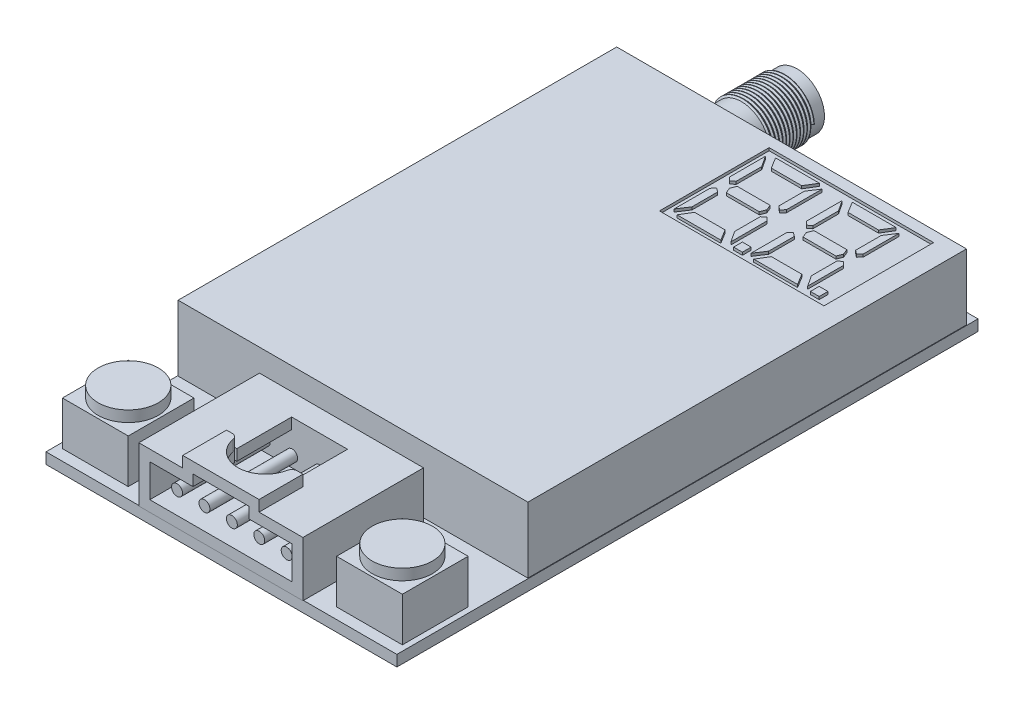
from build123d import *

# Parameters (mm, degrees)
IZIM1_W                       = 32
IZIM1_H                       = 53
Y_KSEKLIK_EKSTR_ZYON1_DEPTH   = 1
IZIM2_W                       = 31.9
IZIM2_H                       = 40
Y_KSEKLIK_EKSTR_ZYON2_DEPTH   = 6
IZIM3_W                       = 6
IZIM3_H                       = 6
Y_KSEKLIK_EKSTR_ZYON5_DEPTH   = 4
IZIM7_R                       = 2.75
Y_KSEKLIK_EKSTR_ZYON6_DEPTH   = 1
Y_KSEKLIK_EKSTR_ZYON8_START   = 0.05
IZIM11_W                      = 14.962008344
IZIM11_H                      = 5
Y_KSEKLIK_EKSTR_ZYON8_DEPTH   = 11
Y_KSEKLIK_EKSTR_ZYON9_DEPTH   = 4
KES_EKSTR_ZYON2_DEPTH         = 4
KES_EKSTR_ZYON1_DEPTH         = 9
IZIM18_W                      = 6
IZIM18_H                      = 6
Y_KSEKLIK_EKSTR_ZYON11_DEPTH  = 1.5
IZIM19_R                      = 2.5
Y_KSEKLIK_EKSTR_ZYON12_DEPTH  = 8
IZIM20_R                      = 2.25
IZIM20_R_2                    = 0.5
KES_EKSTR_ZYON3_DEPTH         = 3
MINCOLWIDTH_ONTRACKING1_PITCH = 0.3175
IZIM25_W                      = 15
IZIM25_H                      = 10
KES_EKSTR_ZYON4_DEPTH         = 0.25
IZIM27_W                      = 0.8
IZIM27_H                      = 0.8
Y_KSEKLIK_EKSTR_ZYON13_DEPTH  = 0.25
IZIM28_R                      = 0.5
Y_KSEKLIK_EKSTR_ZYON14_DEPTH  = 8


with BuildPart() as part:
    # Çizim1 → Yükseklik-Ekstrüzyon1 (new body)
    with BuildSketch(Plane(origin=(0, 0, 0), x_dir=(1, 0, 0), z_dir=(0, 1, 0))):
        Rectangle(IZIM1_W, IZIM1_H)
    extrude(amount=Y_KSEKLIK_EKSTR_ZYON1_DEPTH)

    # Çizim3 → Yükseklik-Ekstrüzyon5 (add)
    with BuildSketch(Plane(origin=(0, 1, 0), x_dir=(1, 0, 0), z_dir=(0, 1, 0))):
        with Locations((12.5, -22.5)):
            Rectangle(IZIM3_W, IZIM3_H)
        with Locations((-12.5, -22.5)):
            Rectangle(IZIM3_W, IZIM3_H)
    extrude(amount=Y_KSEKLIK_EKSTR_ZYON5_DEPTH)

    # Çizim7 → Yükseklik-Ekstrüzyon6 (add)
    with BuildSketch(Plane(origin=(0, 5, 0), x_dir=(1, 0, 0), z_dir=(0, 1, 0))):
        with Locations(Location((-12.5, -22.5, 0), (0, 0, 90))):
            Circle(IZIM7_R)
        with Locations(Location((12.5, -22.5, 0), (0, 0, 90))):
            Circle(IZIM7_R)
    extrude(amount=Y_KSEKLIK_EKSTR_ZYON6_DEPTH)



with BuildPart() as body_2:
    # Çizim2 → Yükseklik-Ekstrüzyon2 (new body)
    with BuildSketch(Plane(origin=(0, 1, 0), x_dir=(1, 0, 0), z_dir=(0, 1, 0))):
        with Locations((0, 5.5)):
            Rectangle(IZIM2_W, IZIM2_H)
    extrude(amount=Y_KSEKLIK_EKSTR_ZYON2_DEPTH)

    # Çizim25 → Kes-Ekstrüzyon4 (cut)
    with BuildSketch(Plane(origin=(0, 7, 0), x_dir=(1, 0, 0), z_dir=(0, 1, 0))):
        with Locations((6.45, 19.5)):
            Rectangle(IZIM25_W, IZIM25_H)
    extrude(amount=-KES_EKSTR_ZYON4_DEPTH, mode=Mode.SUBTRACT)


with BuildPart() as body_3:
    # Çizim11 → Yükseklik-Ekstrüzyon8 (new body)
    with BuildSketch(Plane.XY.offset(26.5).offset(Y_KSEKLIK_EKSTR_ZYON8_START)):
        with Locations((0, 3.5)):
            Rectangle(IZIM11_W, IZIM11_H)
    extrude(amount=-Y_KSEKLIK_EKSTR_ZYON8_DEPTH)


with BuildPart() as part_1:
    add(part.part)

    add(body_3.part)  # Yükseklik-Ekstrüzyon9 merges body 3
    # Çizim15 → Yükseklik-Ekstrüzyon9 (add)
    with BuildSketch(Plane.XY.offset(26.55)):
        Polygon((0, 6), (3.481004172, 6), (3.481004172, 7), (-3.481004172, 7), (-3.481004172, 6), align=None)
    extrude(amount=-Y_KSEKLIK_EKSTR_ZYON9_DEPTH)

    # Çizim16 → Kes-Ekstrüzyon2 (cut)
    with BuildSketch(Plane(origin=(0, 7, 0), x_dir=(1, 0, 0), z_dir=(0, 1, 0))):
        with BuildLine():
            Line((2.958039892, -22.55), (2, -22.55))
            Line((2, -22.55), (2, -17.55))
            Line((2, -17.55), (-2, -17.55))
            Line((-2, -17.55), (-2, -22.55))
            Line((-2, -22.55), (-2.958039892, -22.55))
            ThreePointArc((-2.958039892, -22.55), (-2.639104087, -22.66492864), (-2.466787715, -22.95688019))
            ThreePointArc((-2.466787715, -22.95688019), (0, -25), (2.466787715, -22.95688019))
            ThreePointArc((2.466787715, -22.95688019), (2.639104087, -22.66492864), (2.958039892, -22.55))
        make_face()
    extrude(amount=-KES_EKSTR_ZYON2_DEPTH, mode=Mode.SUBTRACT)

    # Çizim12 → Kes-Ekstrüzyon1 (cut)
    with BuildSketch(Plane.XY.offset(26.55)):
        Polygon((-6.481004172, 2), (6.481004172, 2), (6.481004172, 5), (2.547818284, 5), (2.547818284, 6.004832737), (-2.547818284, 6.004832737), (-2.547818284, 5), (-6.481004172, 5), align=None)
    extrude(amount=-KES_EKSTR_ZYON1_DEPTH, mode=Mode.SUBTRACT)

    # Çizim18 → Yükseklik-Ekstrüzyon11 (add)
    with BuildSketch(Plane(origin=(0, 0, -26.5), x_dir=(-1, 0, 0), z_dir=(0, 0, -1))):
        with Locations((10, 0.5)):
            Rectangle(IZIM18_W, IZIM18_H)
    extrude(amount=Y_KSEKLIK_EKSTR_ZYON11_DEPTH)

    # Çizim19 → Yükseklik-Ekstrüzyon12 (add)
    with BuildSketch(Plane(origin=(0, 0, -28), x_dir=(-1, 0, 0), z_dir=(0, 0, -1))):
        with Locations((10, 0.5)):
            Circle(IZIM19_R)
    extrude(amount=Y_KSEKLIK_EKSTR_ZYON12_DEPTH)

    # Çizim20 → Kes-Ekstrüzyon3 (cut)
    with BuildSketch(Plane(origin=(0, 0, -36), x_dir=(-1, 0, 0), z_dir=(0, 0, -1))):
        with Locations((10, 0.5)):
            Circle(IZIM20_R)
        with Locations((10, 0.5)):
            Circle(IZIM20_R_2, mode=Mode.SUBTRACT)
    extrude(amount=-KES_EKSTR_ZYON3_DEPTH, mode=Mode.SUBTRACT)

    # MinColWidth_OnTracking1: the profile of HeaderRowsCount1 profile screwed along a right-hand helix of 12.598425 turns, 6 arcs to a turn; built about Z, then put on its axis
    mincolwidth_ontracking1_z = Axis((0, 0, 0), (0, 0, 1))
    mincolwidth_ontracking1_corners = [(2.4997, 0, -0.000173205), (2.671851915, 0, 0.09921875), (2.671851915, 0, 0.13890625), (2.4997, 0, 0.238298204)]
    with BuildLine(mode=Mode.PRIVATE) as mincolwidth_ontracking1_profile:
        Line(mincolwidth_ontracking1_corners[0], mincolwidth_ontracking1_corners[1])
        Line(mincolwidth_ontracking1_corners[1], mincolwidth_ontracking1_corners[2])
        Line(mincolwidth_ontracking1_corners[2], mincolwidth_ontracking1_corners[3])
        Line(mincolwidth_ontracking1_corners[3], mincolwidth_ontracking1_corners[0])
    mincolwidth_ontracking1_cap = Face(mincolwidth_ontracking1_profile.wire())
    mincolwidth_ontracking1_turn_angles = [0, 30, 60, 90, 120, 150, 180, 210, 240, 270, 300, 330, 360]
    mincolwidth_ontracking1_turn_weights = [1, 0.8660254037844387, 1, 0.8660254037844387, 1, 0.8660254037844387, 1, 0.8660254037844387, 1, 0.8660254037844387, 1, 0.8660254037844387, 1]
    mincolwidth_ontracking1_turn_rails = [Edge.make_bspline([Vector(p[0], p[1], 0).rotate(mincolwidth_ontracking1_z, mincolwidth_ontracking1_turn_angles[k]) / mincolwidth_ontracking1_turn_weights[k] + Vector(0, 0, p[2] + MINCOLWIDTH_ONTRACKING1_PITCH * mincolwidth_ontracking1_turn_angles[k] / 360) for k in range(13)], [0, 0, 0, 1, 1, 2, 2, 3, 3, 4, 4, 5, 5, 6, 6, 6], 2, mincolwidth_ontracking1_turn_weights) for p in mincolwidth_ontracking1_corners]
    mincolwidth_ontracking1_turn_sides = [Face.make_surface_from_curves(mincolwidth_ontracking1_turn_rails[p[0]], mincolwidth_ontracking1_turn_rails[p[1]]) for p in [(0, 1), (1, 2), (2, 3), (3, 0)]]
    mincolwidth_ontracking1_last_angles = [4320, 4350, 4380, 4410, 4440, 4470, 4500, 4517.716535433, 4535.433070866]
    mincolwidth_ontracking1_last_weights = [1, 0.8660254037844387, 1, 0.8660254037844387, 1, 0.8660254037844387, 1, 0.9525736983244478, 1]
    mincolwidth_ontracking1_last_rails = [Edge.make_bspline([Vector(p[0], p[1], 0).rotate(mincolwidth_ontracking1_z, mincolwidth_ontracking1_last_angles[k]) / mincolwidth_ontracking1_last_weights[k] + Vector(0, 0, p[2] + MINCOLWIDTH_ONTRACKING1_PITCH * mincolwidth_ontracking1_last_angles[k] / 360) for k in range(9)], [0, 0, 0, 1, 1, 2, 2, 3, 3, 4, 4, 4], 2, mincolwidth_ontracking1_last_weights) for p in mincolwidth_ontracking1_corners]
    mincolwidth_ontracking1_last_sides = [Face.make_surface_from_curves(mincolwidth_ontracking1_last_rails[p[0]], mincolwidth_ontracking1_last_rails[p[1]]) for p in [(0, 1), (1, 2), (2, 3), (3, 0)]]
    mincolwidth_ontracking1 = Plane(origin=(-10, 0.5, -35), x_dir=(1, 0, 0), z_dir=(0, 0, 1)) * Solid(Shell([*[p.moved(Location((0, 0, MINCOLWIDTH_ONTRACKING1_PITCH * i))) for i in range(12) for p in mincolwidth_ontracking1_turn_sides], *mincolwidth_ontracking1_last_sides, mincolwidth_ontracking1_cap, mincolwidth_ontracking1_cap.rotate(mincolwidth_ontracking1_z, 4535.433070866).moved(Location((0, 0, MINCOLWIDTH_ONTRACKING1_PITCH * 4535.433070866 / 360)))]))
    add(mincolwidth_ontracking1)


    add(body_2.part)  # Yükseklik-Ekstrüzyon13 merges body 2
    # Çizim27 → Yükseklik-Ekstrüzyon13 (add)
    with BuildSketch(Plane(origin=(0, 6.75, 0), x_dir=(1, 0, 0), z_dir=(0, 1, 0))):
        Polygon((0.664771137, 22.983042347), (0.053377685, 23.983042347), (4.053377685, 23.983042347), (3.441984232, 22.983042347), align=None)
        Polygon((4.342102553, 20.072969491), (3.9997405, 20.335985377), (3.9997405, 22.670153942), (4.643229286, 23.649809054), (4.643229286, 20.381168795), align=None)
        Polygon((0.553377685, 18.987819224), (0.664771137, 18.987819224), (3.441984232, 18.987819224), (3.553377685, 18.987819224), (3.751485955, 19.487819224), (3.553377685, 19.987819224), (3.441984232, 19.987819224), (0.664771137, 19.987819224), (0.553377685, 19.987819224), (0.355269415, 19.487819224), align=None)
        Polygon((0.107014869, 22.670153942), (0.107014869, 20.335985377), (-0.235347184, 20.072969491), (-0.536473917, 20.381168795), (-0.536473917, 23.649809054), align=None)
        Polygon((-0.235347184, 18.902668958), (0.107014869, 18.639653071), (0.107014869, 16.305484506), (-0.536473917, 15.325829395), (-0.536473917, 18.594469653), align=None)
        Polygon((3.441984232, 15.992596102), (4.053377685, 14.992596102), (0.053377685, 14.992596102), (0.664771137, 15.992596102), align=None)
        Polygon((3.9997405, 16.305484506), (3.9997405, 18.639653071), (4.342102553, 18.902668958), (4.643229286, 18.594469653), (4.643229286, 15.325829395), align=None)
        with Locations((5.589399196, 15.424217029)):
            Rectangle(IZIM27_W, IZIM27_H)
        Polygon((6.764652816, 18.902668958), (7.107014869, 18.639653071), (7.107014869, 16.305484506), (6.463526083, 15.325829395), (6.463526083, 18.594469653), align=None)
        Polygon((7.553377685, 18.987819224), (7.664771137, 18.987819224), (10.441984232, 18.987819224), (10.553377685, 18.987819224), (10.751485955, 19.487819224), (10.553377685, 19.987819224), (10.441984232, 19.987819224), (7.664771137, 19.987819224), (7.553377685, 19.987819224), (7.355269415, 19.487819224), align=None)
        Polygon((7.107014869, 22.670153942), (7.107014869, 20.335985377), (6.764652816, 20.072969491), (6.463526083, 20.381168795), (6.463526083, 23.649809054), align=None)
        Polygon((7.664771137, 22.983042347), (7.053377685, 23.983042347), (11.053377685, 23.983042347), (10.441984232, 22.983042347), align=None)
        Polygon((11.342102553, 20.072969491), (10.9997405, 20.335985377), (10.9997405, 22.670153942), (11.643229286, 23.649809054), (11.643229286, 20.381168795), align=None)
        Polygon((10.9997405, 16.305484506), (10.9997405, 18.639653071), (11.342102553, 18.902668958), (11.643229286, 18.594469653), (11.643229286, 15.325829395), align=None)
        Polygon((10.441984232, 15.992596102), (11.053377685, 14.992596102), (7.053377685, 14.992596102), (7.664771137, 15.992596102), align=None)
        with Locations((12.589399196, 15.424217029)):
            Rectangle(IZIM27_W, IZIM27_H)
    extrude(amount=Y_KSEKLIK_EKSTR_ZYON13_DEPTH)

    # Çizim28 → Yükseklik-Ekstrüzyon14 (add)
    with BuildSketch(Plane.XY.offset(17.55)):
        with Locations(Location((0, 3, 0), (0, 0, 180))):
            Circle(IZIM28_R)
        with Locations(Location((2.5, 3, 0), (0, 0, 180))):
            Circle(IZIM28_R)
        with Locations(Location((5, 3, 0), (0, 0, 180))):
            Circle(IZIM28_R)
        with Locations(Location((-5, 3, 0), (0, 0, 180))):
            Circle(IZIM28_R)
        with Locations(Location((-2.5, 3, 0), (0, 0, 180))):
            Circle(IZIM28_R)
    extrude(amount=Y_KSEKLIK_EKSTR_ZYON14_DEPTH)


solid = part_1.part
